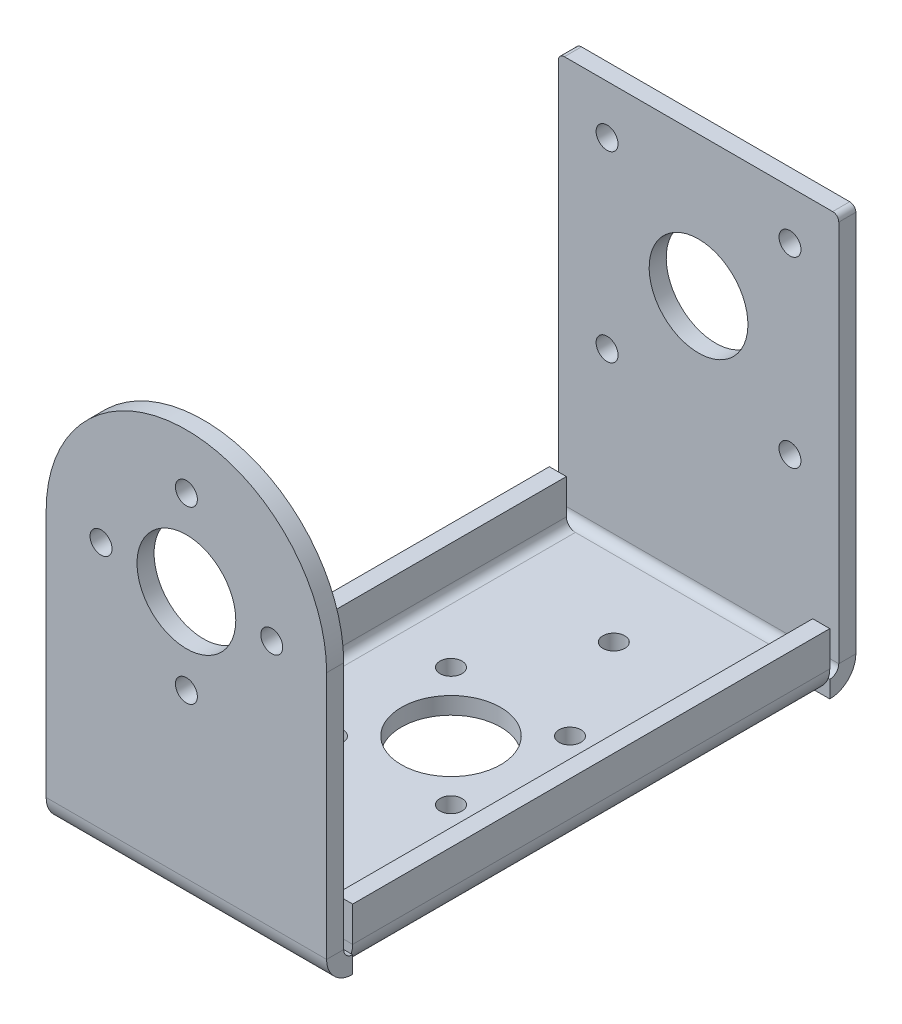
from build123d import *

# Parameters (mm, degrees)
BASE_FLANGE1_START             = -11.5
BASE_FLANGE1_DEPTH             = 23
EDGE_FLANGE1_STRIP_W           = 7.0732
EDGE_FLANGE1_STRIP_H           = 1.4
EDGE_FLANGE1_STRIP_CUT_DEPTH   = 39.1268
EDGE_FLANGE1_STRIP_2_W         = 7.0732
EDGE_FLANGE1_STRIP_2_H         = 1.4
EDGE_FLANGE1_STRIP_CUT_2_DEPTH = 39.1268
EDGE_FLANGE1_DEPTH             = 39.1268
EDGE_FLANGE1_BEND_DEPTH        = 39.1268
FILLET1_RADIUS                 = 11.5
FILLET1_LENGTH                 = 1.4
CUT_EXTRUDE1_REACH             = 58.319
SKETCH12_R                     = 4.05
SKETCH12_R_2                   = 0.9
SKETCH13_R                     = 4.075
SKETCH13_R_2                   = 0.9
CUT_EXTRUDE2_DEPTH             = 42.942102952
FILLET2_R                      = 0.5
CUT_EXTRUDE3_REACH             = 58.319
SKETCH14_R                     = 4.05
SKETCH14_R_2                   = 0.9


# Read off the part's stored shape, not the designer's step: Base-Flange1
# Sheet-metal steps are written as plain solids
with BuildPart() as part:
    # Base-Flange1 outline → Base-Flange1 (new body)
    with BuildSketch(Plane(origin=(0, 0, 0), x_dir=(0, 0, -1), z_dir=(1, 0, 0)).offset(BASE_FLANGE1_START)):
        with BuildLine():
            Line((21.7, 2.1366), (21.7, 34))
            Line((21.7, 34), (20.3, 34))
            Line((20.3, 34), (20.3, 2.1366))
            ThreePointArc((20.3, 2.1366), (20.084254855, 1.615745145), (19.5634, 1.4))
            Line((19.5634, 1.4), (-19.5634, 1.4))
            ThreePointArc((-19.5634, 1.4), (-20.084254855, 1.615745145), (-20.3, 2.1366))
            Line((-20.3, 2.1366), (-20.3, 34))
            Line((-20.3, 34), (-21.7, 34))
            Line((-21.7, 34), (-21.7, 2.1366))
            ThreePointArc((-21.7, 2.1366), (-21.074204349, 0.625795651), (-19.5634, 0))
            Line((-19.5634, 0), (19.5634, 0))
            ThreePointArc((19.5634, 0), (21.074204349, 0.625795651), (21.7, 2.1366))
        make_face()
    extrude(amount=BASE_FLANGE1_DEPTH)

    # Edge-Flange1 strip (across the edge) → Edge-Flange1 strip cut (cut)
    with BuildSketch(Plane(origin=(11.5, 1.4, 19.5634), x_dir=(-1, 0, 0), z_dir=(0, 0, -1))):
        with Locations((-1.4, -0.7)):
            Rectangle(EDGE_FLANGE1_STRIP_W, EDGE_FLANGE1_STRIP_H)
    extrude(amount=EDGE_FLANGE1_STRIP_CUT_DEPTH, mode=Mode.SUBTRACT)

    # Edge-Flange1 strip 2 (across the edge) → Edge-Flange1 strip cut 2 (cut)
    with BuildSketch(Plane(origin=(-11.5, 1.4, -19.5634), x_dir=(1, 0, 0), z_dir=(0, 0, 1))):
        with Locations((-1.4, -0.7)):
            Rectangle(EDGE_FLANGE1_STRIP_2_W, EDGE_FLANGE1_STRIP_2_H)
    extrude(amount=EDGE_FLANGE1_STRIP_CUT_2_DEPTH, mode=Mode.SUBTRACT)

    # Edge-Flange1 section (across the edge) → Edge-Flange1 (add)
    with BuildSketch(Plane(origin=(11.5, 1.4, 19.5634), x_dir=(-1, 0, 0), z_dir=(0, 0, -1))):
        with BuildLine():
            Line((0, 0.7366), (0, 3.6))
            Line((0, 3.6), (1.4, 3.6))
            Line((1.4, 3.6), (1.4, 0.7366))
            ThreePointArc((1.4, 0.7366), (1.615745145, 0.215745145), (2.1366, 0))
            Line((2.1366, 0), (2.1366, -1.4))
            ThreePointArc((2.1366, -1.4), (0.625795651, -0.774204349), (0, 0.7366))
        make_face()
    extrude(amount=EDGE_FLANGE1_DEPTH)

    # Edge-Flange1 section 2 (across the edge) → Edge-Flange1 bend (add)
    with BuildSketch(Plane(origin=(-11.5, 1.4, -19.5634), x_dir=(1, 0, 0), z_dir=(0, 0, 1))):
        with BuildLine():
            Line((0, 0.7366), (0, 3.6))
            Line((0, 3.6), (1.4, 3.6))
            Line((1.4, 3.6), (1.4, 0.7366))
            ThreePointArc((1.4, 0.7366), (1.615745145, 0.215745145), (2.1366, 0))
            Line((2.1366, 0), (2.1366, -1.4))
            ThreePointArc((2.1366, -1.4), (0.625795651, -0.774204349), (0, 0.7366))
        make_face()
    extrude(amount=EDGE_FLANGE1_BEND_DEPTH)

    # Fillet1: full round fillet: the end face becomes a half cylinder, R = half its width
    fillet1_face = Plane((0, 34, 21), x_dir=(0, 0, 1), z_dir=(0, 1, 0))  # on the end face: x along it, z out of the body
    fillet1_slab = fillet1_face.offset(-FILLET1_RADIUS / 2) * Box(FILLET1_LENGTH, 2 * FILLET1_RADIUS, FILLET1_RADIUS, mode=Mode.PRIVATE)  # the body's end, R deep
    fillet1_round = Plane((0, 22.5, 21), x_dir=(0, 1, 0), z_dir=(0, 0, 1)) * Cylinder(FILLET1_RADIUS, FILLET1_LENGTH, mode=Mode.PRIVATE)  # its axis R under the face
    add(fillet1_slab - fillet1_round, mode=Mode.SUBTRACT)

    # Sketch12 → Cut-Extrude1 (cut, up to next)
    with BuildSketch(Plane.XY.offset(21.7), mode=Mode.PRIVATE) as cut_extrude1_sk1:
        with Locations((0, 22.5)):
            Circle(SKETCH12_R)
    cut_extrude1_tool1 = extrude(cut_extrude1_sk1.sketch, amount=-CUT_EXTRUDE1_REACH, mode=Mode.PRIVATE) & part.part
    # Sketch12 → Cut-Extrude1 (cut, up to next)
    with BuildSketch(Plane.XY.offset(21.7), mode=Mode.PRIVATE) as cut_extrude1_sk2:
        with Locations((0, 29.5)):
            Circle(SKETCH12_R_2)
    cut_extrude1_tool2 = extrude(cut_extrude1_sk2.sketch, amount=-CUT_EXTRUDE1_REACH, mode=Mode.PRIVATE) & part.part
    # Sketch12 → Cut-Extrude1 (cut, up to next)
    with BuildSketch(Plane.XY.offset(21.7), mode=Mode.PRIVATE) as cut_extrude1_sk3:
        with Locations((7, 22.5)):
            Circle(SKETCH12_R_2)
    cut_extrude1_tool3 = extrude(cut_extrude1_sk3.sketch, amount=-CUT_EXTRUDE1_REACH, mode=Mode.PRIVATE) & part.part
    # Sketch12 → Cut-Extrude1 (cut, up to next)
    with BuildSketch(Plane.XY.offset(21.7), mode=Mode.PRIVATE) as cut_extrude1_sk4:
        with Locations((0, 15.5)):
            Circle(SKETCH12_R_2)
    cut_extrude1_tool4 = extrude(cut_extrude1_sk4.sketch, amount=-CUT_EXTRUDE1_REACH, mode=Mode.PRIVATE) & part.part
    # Sketch12 → Cut-Extrude1 (cut, up to next)
    with BuildSketch(Plane.XY.offset(21.7), mode=Mode.PRIVATE) as cut_extrude1_sk5:
        with Locations((-7, 22.5)):
            Circle(SKETCH12_R_2)
    cut_extrude1_tool5 = extrude(cut_extrude1_sk5.sketch, amount=-CUT_EXTRUDE1_REACH, mode=Mode.PRIVATE) & part.part
    add(cut_extrude1_tool1.solids().sort_by_distance((0, 22.5, 21.7))[0], mode=Mode.SUBTRACT)
    add(cut_extrude1_tool2.solids().sort_by_distance((0, 29.5, 21.7))[0], mode=Mode.SUBTRACT)
    add(cut_extrude1_tool3.solids().sort_by_distance((7, 22.5, 21.7))[0], mode=Mode.SUBTRACT)
    add(cut_extrude1_tool4.solids().sort_by_distance((0, 15.5, 21.7))[0], mode=Mode.SUBTRACT)
    add(cut_extrude1_tool5.solids().sort_by_distance((-7, 22.5, 21.7))[0], mode=Mode.SUBTRACT)

    # Sketch13 → Cut-Extrude2 (cut, through all)
    with BuildSketch(Plane(origin=(0, 0, 0), x_dir=(1, 0, 0), z_dir=(0, 1, 0))):
        with Locations(Location((0, 0, 0), (0, 0, 270))):
            Circle(SKETCH13_R)
        with Locations(Location((-4.87903679, 4.87903679, 0), (0, 0, 270))):
            Circle(SKETCH13_R_2)
        with Locations(Location((4.87903679, 4.87903679, 0), (0, 0, 270))):
            Circle(SKETCH13_R_2)
        with Locations(Location((4.87903679, -4.87903679, 0), (0, 0, 270))):
            Circle(SKETCH13_R_2)
        with Locations(Location((-4.87903679, -4.87903679, 0), (0, 0, 270))):
            Circle(SKETCH13_R_2)
        with Locations(Location((0, 13.35, 0), (0, 0, 270))):
            Circle(SKETCH13_R_2)
        with Locations(Location((0, -13.35, 0), (0, 0, 90))):
            Circle(SKETCH13_R_2)
    extrude(amount=CUT_EXTRUDE2_DEPTH, mode=Mode.SUBTRACT)

    # Fillet2
    fillet2_edges = [part.edges().sort_by_distance(p)[0] for p in [
        (-11.5, 34, -21),
        (11.5, 34, -21),
    ]]
    fillet(fillet2_edges, radius=FILLET2_R)

    # Sketch14 → Cut-Extrude3 (cut, up to next)
    with BuildSketch(Plane(origin=(0, 0, -21.7), x_dir=(-1, 0, 0), z_dir=(0, 0, -1)), mode=Mode.PRIVATE) as cut_extrude3_sk1:
        with Locations(Location((0, 22.5, 0), (0, 0, 180))):
            Circle(SKETCH14_R)
    cut_extrude3_tool1 = extrude(cut_extrude3_sk1.sketch, amount=-CUT_EXTRUDE3_REACH, mode=Mode.PRIVATE) & part.part
    # Sketch14 → Cut-Extrude3 (cut, up to next)
    with BuildSketch(Plane(origin=(0, 0, -21.7), x_dir=(-1, 0, 0), z_dir=(0, 0, -1)), mode=Mode.PRIVATE) as cut_extrude3_sk2:
        with Locations(Location((-7.5, 30, 0), (0, 0, 90))):
            Circle(SKETCH14_R_2)
    cut_extrude3_tool2 = extrude(cut_extrude3_sk2.sketch, amount=-CUT_EXTRUDE3_REACH, mode=Mode.PRIVATE) & part.part
    # Sketch14 → Cut-Extrude3 (cut, up to next)
    with BuildSketch(Plane(origin=(0, 0, -21.7), x_dir=(-1, 0, 0), z_dir=(0, 0, -1)), mode=Mode.PRIVATE) as cut_extrude3_sk3:
        with Locations(Location((7.5, 30, 0), (0, 0, 90))):
            Circle(SKETCH14_R_2)
    cut_extrude3_tool3 = extrude(cut_extrude3_sk3.sketch, amount=-CUT_EXTRUDE3_REACH, mode=Mode.PRIVATE) & part.part
    # Sketch14 → Cut-Extrude3 (cut, up to next)
    with BuildSketch(Plane(origin=(0, 0, -21.7), x_dir=(-1, 0, 0), z_dir=(0, 0, -1)), mode=Mode.PRIVATE) as cut_extrude3_sk4:
        with Locations(Location((7.5, 15, 0), (0, 0, 90))):
            Circle(SKETCH14_R_2)
    cut_extrude3_tool4 = extrude(cut_extrude3_sk4.sketch, amount=-CUT_EXTRUDE3_REACH, mode=Mode.PRIVATE) & part.part
    # Sketch14 → Cut-Extrude3 (cut, up to next)
    with BuildSketch(Plane(origin=(0, 0, -21.7), x_dir=(-1, 0, 0), z_dir=(0, 0, -1)), mode=Mode.PRIVATE) as cut_extrude3_sk5:
        with Locations(Location((-7.5, 15, 0), (0, 0, 90))):
            Circle(SKETCH14_R_2)
    cut_extrude3_tool5 = extrude(cut_extrude3_sk5.sketch, amount=-CUT_EXTRUDE3_REACH, mode=Mode.PRIVATE) & part.part
    add(cut_extrude3_tool1.solids().sort_by_distance((0, 22.5, -21.7))[0], mode=Mode.SUBTRACT)
    add(cut_extrude3_tool2.solids().sort_by_distance((7.5, 30, -21.7))[0], mode=Mode.SUBTRACT)
    add(cut_extrude3_tool3.solids().sort_by_distance((-7.5, 30, -21.7))[0], mode=Mode.SUBTRACT)
    add(cut_extrude3_tool4.solids().sort_by_distance((-7.5, 15, -21.7))[0], mode=Mode.SUBTRACT)
    add(cut_extrude3_tool5.solids().sort_by_distance((7.5, 15, -21.7))[0], mode=Mode.SUBTRACT)


solid = part.part
